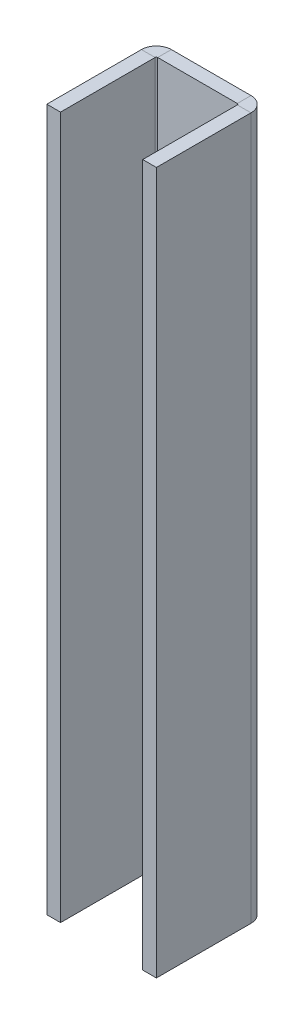
from build123d import *

# Parameters (mm, degrees)
SM_START                           = -4
SM_BASE_FLANGE_1_OUTLINE_W         = 64
SM_BASE_FLANGE_1_OUTLINE_H         = 410
SM_BASE_FLANGE_1_DEPTH             = 8
SM_EDGE_FLANGE_1_STRIP_W           = 33.4732
SM_EDGE_FLANGE_1_STRIP_H           = 8
SM_EDGE_FLANGE_1_STRIP_CUT_DEPTH   = 410
SM_EDGE_FLANGE_1_STRIP_2_W         = 33.4732
SM_EDGE_FLANGE_1_STRIP_2_H         = 8
SM_EDGE_FLANGE_1_STRIP_CUT_2_DEPTH = 410
SM_EDGE_FLANGE_1_DEPTH             = 410
SM_EDGE_FLANGE_1_BEND_DEPTH        = 410


# Read off the part's stored shape, not the designer's step: 基体-法兰1
# Sheet-metal steps are written as plain solids
with BuildPart() as part:
    # 基体-法兰1 outline → 基体-法兰1 (new body)
    with BuildSketch(Plane.XY.offset(SM_START)):
        with Locations((40, 205)):
            Rectangle(SM_BASE_FLANGE_1_OUTLINE_W, SM_BASE_FLANGE_1_OUTLINE_H)
    extrude(amount=SM_BASE_FLANGE_1_DEPTH)

    # 边线-法兰1 strip (across the edge) → 边线-法兰1 strip cut (cut)
    with BuildSketch(Plane(origin=(8, 410, 4), x_dir=(1, 0, 0), z_dir=(0, -1, 0))):
        with Locations((-8, -4)):
            Rectangle(SM_EDGE_FLANGE_1_STRIP_W, SM_EDGE_FLANGE_1_STRIP_H)
    extrude(amount=SM_EDGE_FLANGE_1_STRIP_CUT_DEPTH, mode=Mode.SUBTRACT)

    # 边线-法兰1 strip 2 (across the edge) → 边线-法兰1 strip cut 2 (cut)
    with BuildSketch(Plane(origin=(72, 0, 4), x_dir=(-1, 0, 0), z_dir=(0, 1, 0))):
        with Locations((-8, -4)):
            Rectangle(SM_EDGE_FLANGE_1_STRIP_2_W, SM_EDGE_FLANGE_1_STRIP_2_H)
    extrude(amount=SM_EDGE_FLANGE_1_STRIP_CUT_2_DEPTH, mode=Mode.SUBTRACT)

    # 边线-法兰1 section (across the edge) → 边线-法兰1 (add)
    with BuildSketch(Plane(origin=(8, 410, 4), x_dir=(1, 0, 0), z_dir=(0, -1, 0))):
        with BuildLine():
            Line((0, 0.7366), (0, 56))
            Line((0, 56), (8, 56))
            Line((8, 56), (8, 0.7366))
            ThreePointArc((8, 0.7366), (8.215745145, 0.215745145), (8.7366, 0))
            Line((8.7366, 0), (8.7366, -8))
            ThreePointArc((8.7366, -8), (2.558890895, -5.441109105), (0, 0.7366))
        make_face()
    extrude(amount=SM_EDGE_FLANGE_1_DEPTH)

    # 边线-法兰1 section 2 (across the edge) → 边线-法兰1 bend (add)
    with BuildSketch(Plane(origin=(72, 0, 4), x_dir=(-1, 0, 0), z_dir=(0, 1, 0))):
        with BuildLine():
            Line((0, 0.7366), (0, 56))
            Line((0, 56), (8, 56))
            Line((8, 56), (8, 0.7366))
            ThreePointArc((8, 0.7366), (8.215745145, 0.215745145), (8.7366, 0))
            Line((8.7366, 0), (8.7366, -8))
            ThreePointArc((8.7366, -8), (2.558890895, -5.441109105), (0, 0.7366))
        make_face()
    extrude(amount=SM_EDGE_FLANGE_1_BEND_DEPTH)


solid = part.part
